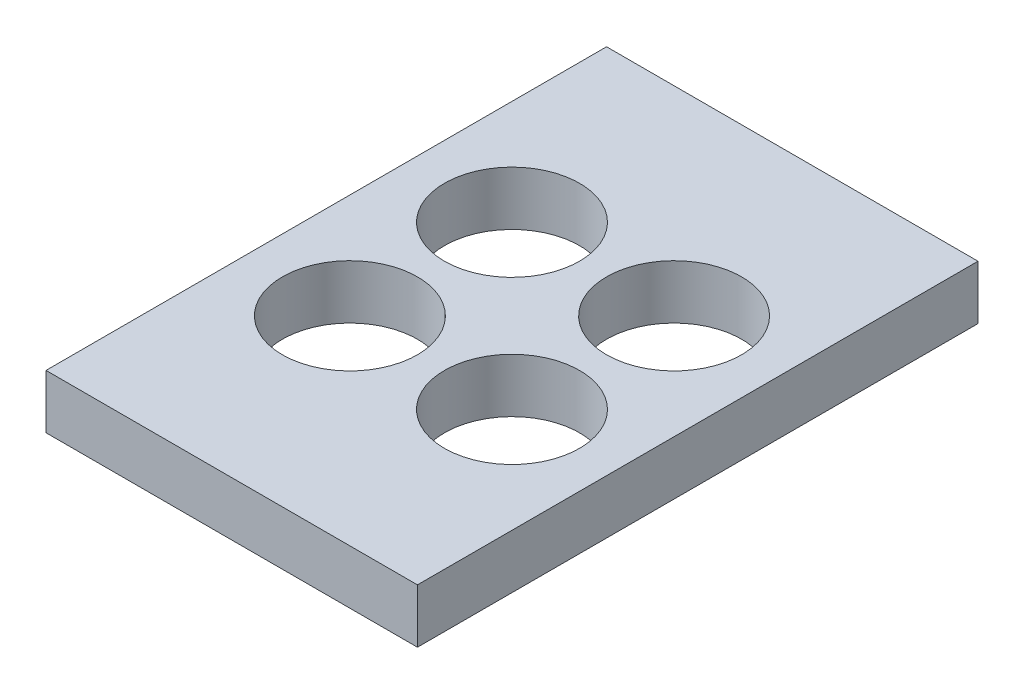
from build123d import *

# Parameters (mm, degrees)
SKETCH1_W           = 13.75
SKETCH1_H           = 20.75
BOSS_EXTRUDE1_DEPTH = 2
SKETCH2_R           = 2.5
CUT_EXTRUDE1_DEPTH  = 13.605802235


with BuildPart() as part:
    # Sketch1 → Boss-Extrude1 (new body)
    with BuildSketch(Plane(origin=(0, 0, 0), x_dir=(1, 0, 0), z_dir=(0, 1, 0))):
        Rectangle(SKETCH1_W, SKETCH1_H)
    extrude(amount=BOSS_EXTRUDE1_DEPTH)

    # Sketch2 → Cut-Extrude1 (cut, through all)
    with BuildSketch(Plane(origin=(0, 2, 0), x_dir=(1, 0, 0), z_dir=(0, 1, 0))):
        with Locations((-3, 3)):
            Circle(SKETCH2_R)
        with Locations((3, 3)):
            Circle(SKETCH2_R)
        with Locations((3, -3)):
            Circle(SKETCH2_R)
        with Locations((-3, -3)):
            Circle(SKETCH2_R)
    extrude(amount=-CUT_EXTRUDE1_DEPTH, mode=Mode.SUBTRACT)


solid = part.part
